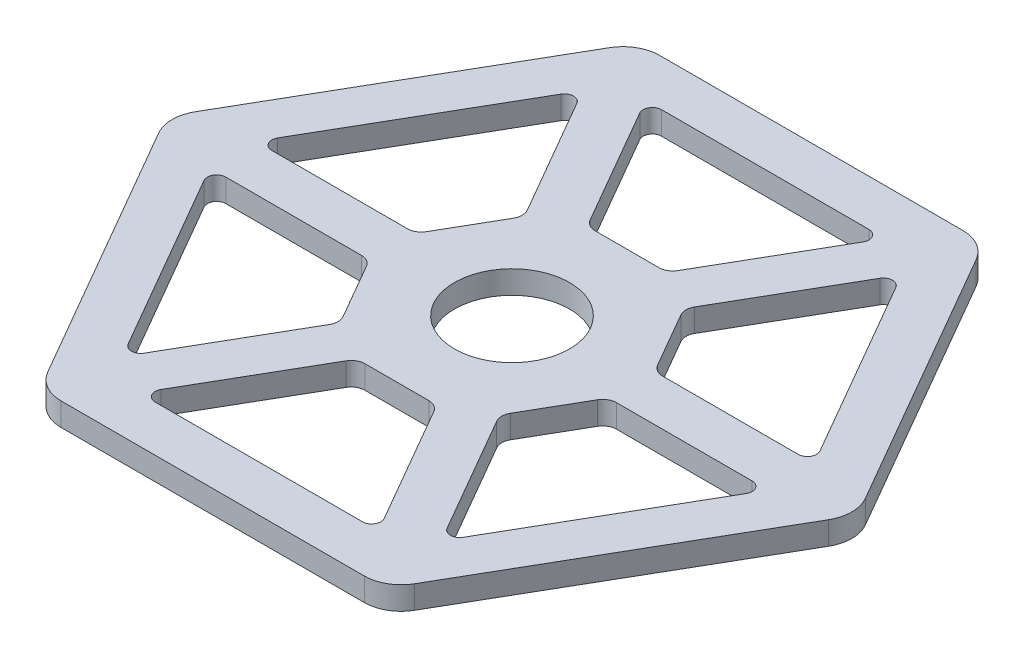
from build123d import *

# Parameters (mm, degrees)
BOSS_EXTRUDE1_DEPTH = 5
FILLET1_R           = 8
SKETCH2_R           = 12.5
CUT_EXTRUDE1_DEPTH  = 10


with BuildPart() as part:
    # Sketch1 → Boss-Extrude1 (new body)
    with BuildSketch(Plane(origin=(0, 0, 0), x_dir=(1, 0, 0), z_dir=(0, 1, 0))):
        Polygon((-75.055534995, 0), (-37.527767497, -65), (37.527767497, -65), (75.055534995, 0), (37.527767497, 65), (-37.527767497, 65), align=None)
    extrude(amount=BOSS_EXTRUDE1_DEPTH)

    # Fillet1
    fillet1_edges = [part.edges().sort_by_distance(p)[0] for p in [
        (37.527767497, 2.5, -65),
        (75.055534995, 2.5, 0),
        (37.527767497, 2.5, 65),
        (-37.527767497, 2.5, 65),
        (-75.055534995, 2.5, 0),
        (-37.527767497, 2.5, -65),
    ]]
    fillet(fillet1_edges, radius=FILLET1_R)

    # Sketch2 → Cut-Extrude1 (cut)
    with BuildSketch(Plane(origin=(0, 5, 0), x_dir=(1, 0, 0), z_dir=(0, 1, 0))):
        Circle(SKETCH2_R)
        with BuildLine():
            Line((9.526279442, 26.5), (24.248711306, 52))
            ThreePointArc((24.248711306, 52), (24.248711306, 54), (22.516660498, 55))
            Line((22.516660498, 55), (-22.516660498, 55))
            ThreePointArc((-22.516660498, 55), (-24.248711306, 54), (-24.248711306, 52))
            Line((-24.248711306, 52), (-9.526279442, 26.5))
            ThreePointArc((-9.526279442, 26.5), (-8.42820323, 25.401923789), (-6.92820323, 25))
            Line((-6.92820323, 25), (6.92820323, 25))
            ThreePointArc((6.92820323, 25), (8.42820323, 25.401923789), (9.526279442, 26.5))
        make_face()
        with BuildLine():
            Line((27.712812921, 5), (57.15767665, 5))
            ThreePointArc((57.15767665, 5), (58.889727457, 6), (58.889727457, 8))
            Line((58.889727457, 8), (36.373066959, 47))
            ThreePointArc((36.373066959, 47), (34.641016151, 48), (32.908965344, 47))
            Line((32.908965344, 47), (18.186533479, 21.5))
            ThreePointArc((18.186533479, 21.5), (17.784609691, 20), (18.186533479, 18.5))
            Line((18.186533479, 18.5), (25.11473671, 6.5))
            ThreePointArc((25.11473671, 6.5), (26.212812921, 5.401923789), (27.712812921, 5))
        make_face()
        with BuildLine():
            Line((18.186533479, -21.5), (32.908965344, -47))
            ThreePointArc((32.908965344, -47), (34.641016151, -48), (36.373066959, -47))
            Line((36.373066959, -47), (58.889727457, -8))
            ThreePointArc((58.889727457, -8), (58.889727457, -6), (57.15767665, -5))
            Line((57.15767665, -5), (27.712812921, -5))
            ThreePointArc((27.712812921, -5), (26.212812921, -5.401923789), (25.11473671, -6.5))
            Line((25.11473671, -6.5), (18.186533479, -18.5))
            ThreePointArc((18.186533479, -18.5), (17.784609691, -20), (18.186533479, -21.5))
        make_face()
        with BuildLine():
            Line((-9.526279442, -26.5), (-24.248711306, -52))
            ThreePointArc((-24.248711306, -52), (-24.248711306, -54), (-22.516660498, -55))
            Line((-22.516660498, -55), (22.516660498, -55))
            ThreePointArc((22.516660498, -55), (24.248711306, -54), (24.248711306, -52))
            Line((24.248711306, -52), (9.526279442, -26.5))
            ThreePointArc((9.526279442, -26.5), (8.42820323, -25.401923789), (6.92820323, -25))
            Line((6.92820323, -25), (-6.92820323, -25))
            ThreePointArc((-6.92820323, -25), (-8.42820323, -25.401923789), (-9.526279442, -26.5))
        make_face()
        with BuildLine():
            Line((-27.712812921, -5), (-57.15767665, -5))
            ThreePointArc((-57.15767665, -5), (-58.889727457, -6), (-58.889727457, -8))
            Line((-58.889727457, -8), (-36.373066959, -47))
            ThreePointArc((-36.373066959, -47), (-34.641016151, -48), (-32.908965344, -47))
            Line((-32.908965344, -47), (-18.186533479, -21.5))
            ThreePointArc((-18.186533479, -21.5), (-17.784609691, -20), (-18.186533479, -18.5))
            Line((-18.186533479, -18.5), (-25.11473671, -6.5))
            ThreePointArc((-25.11473671, -6.5), (-26.212812921, -5.401923789), (-27.712812921, -5))
        make_face()
        with BuildLine():
            Line((-18.186533479, 21.5), (-32.908965344, 47))
            ThreePointArc((-32.908965344, 47), (-34.641016151, 48), (-36.373066959, 47))
            Line((-36.373066959, 47), (-58.889727457, 8))
            ThreePointArc((-58.889727457, 8), (-58.889727457, 6), (-57.15767665, 5))
            Line((-57.15767665, 5), (-27.712812921, 5))
            ThreePointArc((-27.712812921, 5), (-26.212812921, 5.401923789), (-25.11473671, 6.5))
            Line((-25.11473671, 6.5), (-18.186533479, 18.5))
            ThreePointArc((-18.186533479, 18.5), (-17.784609691, 20), (-18.186533479, 21.5))
        make_face()
    extrude(amount=-CUT_EXTRUDE1_DEPTH, mode=Mode.SUBTRACT)


solid = part.part
